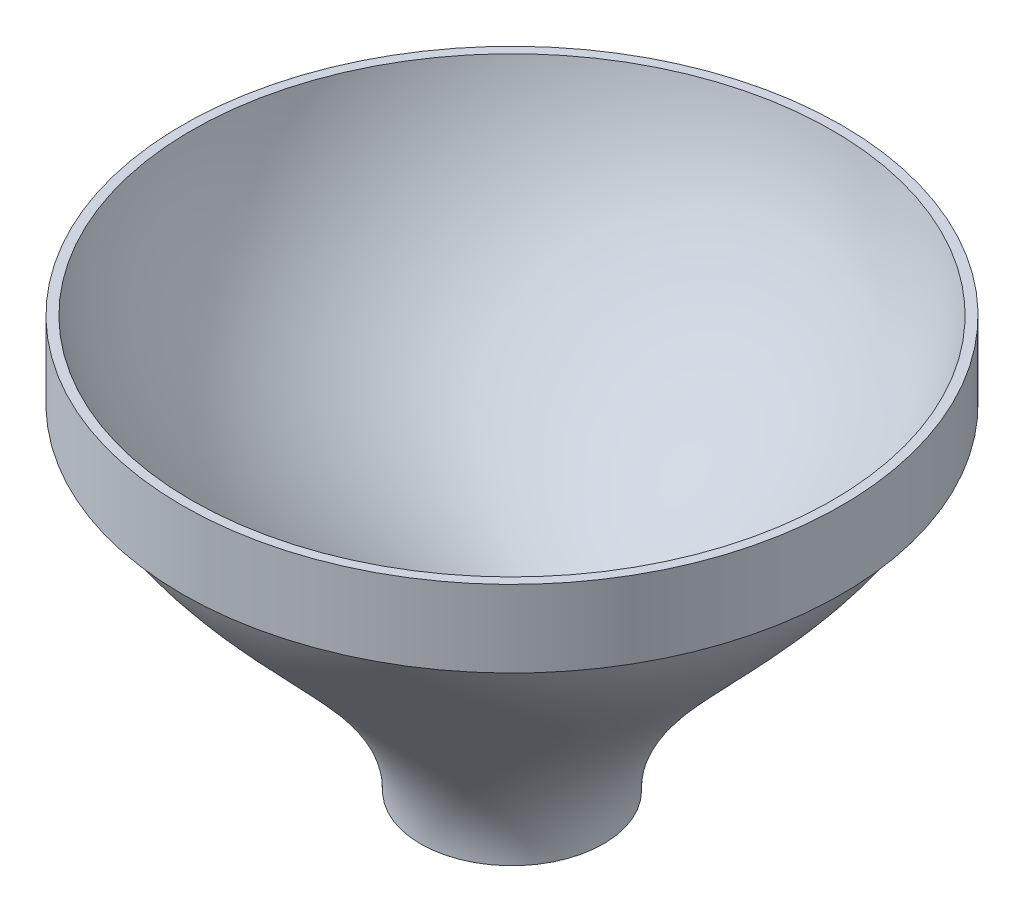
from build123d import *


with BuildPart() as part:
    # Sketch1 → Revolve1 (revolve)
    with BuildSketch(Plane.XY):
        with BuildLine():
            Line((16.834212464, 99.875470661), (18.834212464, 99.875470661))
            add(Edge.make_bspline(
                [(-3.165787536, 135.875470661), (0.490656023, 117.393768165), (18.125405427, 113.98015059), (18.834212464, 99.875470661)],
                knots=[0, 0, 0, 0, 1, 1, 1, 1], degree=3))
            Line((-3.165787536, 135.875470661), (-3.965787536, 135.875470661))
            Line((-3.965787536, 135.875470661), (-3.965787536, 129.16547318))
            Line((-3.965787536, 129.16547318), (-3.165787536, 129.16547318))
            add(Edge.make_bspline(
                [(-3.165787536, 129.16547318), (1.37248923, 118.835586105), (17.093188402, 110.044292054), (16.834212464, 99.875470661)],
                knots=[0, 0, 0, 0, 1, 1, 1, 1], degree=3))
        make_face()
    revolve(axis=Axis((24.834212464, 148.471380655, 0), (0, -1, 0)))


solid = part.part
